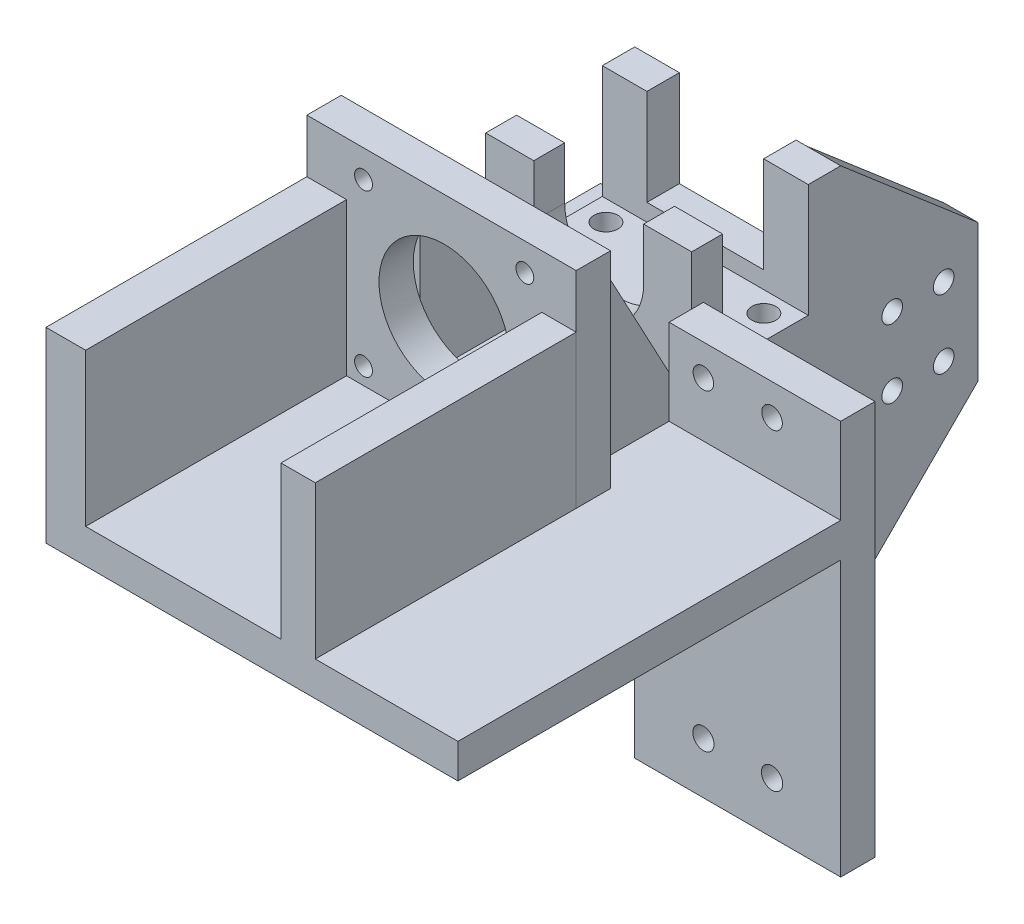
from build123d import *

# Parameters (mm, degrees)
BOSS_EXTRUDE1_DEPTH  = 10
SKETCH2_W            = 60
SKETCH2_H            = 25
BOSS_EXTRUDE2_DEPTH  = 6.45
SKETCH3_W            = 60
SKETCH3_H            = 9.45
BOSS_EXTRUDE3_DEPTH  = 39.45
SKETCH4_W            = 34
SKETCH4_H            = 28
CUT_EXTRUDE1_DEPTH   = 9.45
SKETCH5_W            = 60
SKETCH5_H            = 9
BOSS_EXTRUDE4_DEPTH  = 39.45
CUT_EXTRUDE2_REACH   = 170.798
BOSS_EXTRUDE5_DEPTH  = 80
SKETCH8_W            = 75.99709589
SKETCH8_H            = 54.458409134
BOSS_EXTRUDE6_DEPTH  = 10
SKETCH9_W            = 10
SKETCH9_H            = 75.99709589
BOSS_EXTRUDE7_DEPTH  = 44.46
SKETCH17_W           = 78.45
SKETCH17_H           = 10
BOSS_EXTRUDE27_DEPTH = 60
SKETCH19_W           = 2.5
SKETCH19_H           = 60
BOSS_EXTRUDE31_DEPTH = 32
SKETCH20_W           = 75.99709589
SKETCH20_H           = 44.458409134
BOSS_EXTRUDE32_DEPTH = 1.55
SKETCH21_R           = 2.6
SKETCH21_R_2         = 19
CUT_EXTRUDE3_DEPTH   = 10
CUT_EXTRUDE4_REACH   = 213.153
SKETCH22_R           = 3.5
CUT_EXTRUDE5_REACH   = 191.962
SKETCH23_W           = 27
SKETCH23_H           = 6
CUT_EXTRUDE6_REACH   = 191.962
SKETCH24_R           = 3.1
CUT_EXTRUDE7_REACH   = 177.882
SKETCH25_R           = 3.1
CUT_EXTRUDE10_DEPTH  = 70
SKETCH27_W           = 50
SKETCH27_H           = 10
BOSS_EXTRUDE33_DEPTH = 25
CUT_EXTRUDE11_REACH  = 177.882
SKETCH28_R           = 3
SKETCH29_W           = 10
SKETCH29_H           = 40
BOSS_EXTRUDE34_DEPTH = 40
CUT_EXTRUDE12_REACH  = 226.958
SKETCH30_R           = 3
BOSS_EXTRUDE35_DEPTH = 10
SKETCH34_W           = 85.51
SKETCH34_H           = 10
BOSS_EXTRUDE37_DEPTH = 10


with BuildPart() as part:
    # Sketch1 → Boss-Extrude1 (new body)
    with BuildSketch(Plane(origin=(0, 0, 0), x_dir=(1, 0, 0), z_dir=(0, 1, 0))):
        Polygon((0, 0), (0, 161.51), (60, 161.51), (60, 121.51), (110, 121.51), (110, 0), align=None)
    extrude(amount=BOSS_EXTRUDE1_DEPTH)

    # Sketch2 → Boss-Extrude2 (add)
    with BuildSketch(Plane(origin=(0, 10, 0), x_dir=(1, 0, 0), z_dir=(0, 1, 0))):
        with Locations((30, 139.6)):
            Rectangle(SKETCH2_W, SKETCH2_H)
    extrude(amount=BOSS_EXTRUDE2_DEPTH)

    # Sketch3 → Boss-Extrude3 (add)
    with BuildSketch(Plane(origin=(0, 10, 0), x_dir=(1, 0, 0), z_dir=(0, 1, 0))):
        with Locations((30, 156.785)):
            Rectangle(SKETCH3_W, SKETCH3_H)
    extrude(amount=BOSS_EXTRUDE3_DEPTH)

    # Sketch4 → Cut-Extrude1 (cut)
    with BuildSketch(Plane(origin=(0, 0, -161.51), x_dir=(-1, 0, 0), z_dir=(0, 0, -1))):
        with Locations((-30, 35.45)):
            Rectangle(SKETCH4_W, SKETCH4_H)
    extrude(amount=-CUT_EXTRUDE1_DEPTH, mode=Mode.SUBTRACT)

    # Sketch5 → Boss-Extrude4 (add)
    with BuildSketch(Plane(origin=(0, 10, 0), x_dir=(1, 0, 0), z_dir=(0, 1, 0))):
        with Locations((30, 122.6)):
            Rectangle(SKETCH5_W, SKETCH5_H)
    extrude(amount=BOSS_EXTRUDE4_DEPTH)

    # Sketch6 → Cut-Extrude2 (cut, up to next)
    with BuildSketch(Plane.XY.offset(-118.1), mode=Mode.PRIVATE) as cut_extrude2_sk1:
        with BuildLine():
            Line((14, 34.24), (14, 49.45))
            Line((14, 49.45), (46, 49.45))
            Line((46, 49.45), (46, 34.24))
            ThreePointArc((46, 34.24), (30, 18.24), (14, 34.24))
        make_face()
    cut_extrude2_tool1 = extrude(cut_extrude2_sk1.sketch, amount=-CUT_EXTRUDE2_REACH, mode=Mode.PRIVATE) & part.part
    add(cut_extrude2_tool1.solids().sort_by_distance((30, 35.332249, -118.1))[0], mode=Mode.SUBTRACT)

    # Sketch7 → Boss-Extrude5 (add)
    with BuildSketch(Plane.XZ):
        Polygon((110, -111.51), (50, -111.51), (50, -161.51), (60, -161.51), (60, -121.51), (110, -121.51), align=None)
    extrude(amount=BOSS_EXTRUDE5_DEPTH)

    # Sketch8 → Boss-Extrude6 (add)
    with BuildSketch(Plane.ZY):
        with Locations((-37.998547945, 27.229204567)):
            Rectangle(SKETCH8_W, SKETCH8_H)
    extrude(amount=BOSS_EXTRUDE6_DEPTH)

    # Sketch9 → Boss-Extrude7 (add)
    with BuildSketch(Plane(origin=(0, 10, 0), x_dir=(1, 0, 0), z_dir=(0, 1, 0))):
        with Locations((63.45, 37.998547945)):
            Rectangle(SKETCH9_W, SKETCH9_H)
    extrude(amount=BOSS_EXTRUDE7_DEPTH)

    # Sketch17 → Boss-Extrude27 (add)
    with BuildSketch(Plane(origin=(0, 10, 0), x_dir=(1, 0, 0), z_dir=(0, 1, 0))):
        with Locations((29.225, 81)):
            Rectangle(SKETCH17_W, SKETCH17_H)
    extrude(amount=BOSS_EXTRUDE27_DEPTH)

    # Sketch19 → Boss-Extrude31 (add)
    with BuildSketch(Plane(origin=(0, 0, -86), x_dir=(-1, 0, 0), z_dir=(0, 0, -1))):
        with Locations((-1.25, 40)):
            Rectangle(SKETCH19_W, SKETCH19_H)
        with Locations((-11.75, 40)):
            Rectangle(SKETCH19_W, SKETCH19_H)
        with Locations((-48.25, 40)):
            Rectangle(SKETCH19_W, SKETCH19_H)
        with Locations((-58.75, 40)):
            Rectangle(SKETCH19_W, SKETCH19_H)
    extrude(amount=BOSS_EXTRUDE31_DEPTH)

    # Sketch20 → Boss-Extrude32 (add)
    with BuildSketch(Plane(origin=(0, 0, 0), x_dir=(0, 0, -1), z_dir=(1, 0, 0))):
        with Locations((37.998547945, 32.229204567)):
            Rectangle(SKETCH20_W, SKETCH20_H)
    extrude(amount=BOSS_EXTRUDE32_DEPTH)

    # Sketch21 → Cut-Extrude3 (cut)
    with BuildSketch(Plane.XY.offset(-76)):
        with Locations((6.5, 61.95)):
            Circle(SKETCH21_R)
        with Locations((53.5, 61.95)):
            Circle(SKETCH21_R)
        with Locations((53.5, 14.95)):
            Circle(SKETCH21_R)
        with Locations((6.5, 14.95)):
            Circle(SKETCH21_R)
        with Locations((30, 38.45)):
            Circle(SKETCH21_R_2)
    extrude(amount=-CUT_EXTRUDE3_DEPTH, mode=Mode.SUBTRACT)

    # Sketch22 → Cut-Extrude4 (cut, up to next)
    with BuildSketch(Plane.XZ, mode=Mode.PRIVATE) as cut_extrude4_sk1:
        with Locations((7.02, -146.1)):
            Circle(SKETCH22_R)
    cut_extrude4_tool1 = extrude(cut_extrude4_sk1.sketch, amount=-CUT_EXTRUDE4_REACH, mode=Mode.PRIVATE) & part.part
    # Sketch22 → Cut-Extrude4 (cut, up to next)
    with BuildSketch(Plane.XZ, mode=Mode.PRIVATE) as cut_extrude4_sk2:
        with Locations((7.02, -133)):
            Circle(SKETCH22_R)
    cut_extrude4_tool2 = extrude(cut_extrude4_sk2.sketch, amount=-CUT_EXTRUDE4_REACH, mode=Mode.PRIVATE) & part.part
    # Sketch22 → Cut-Extrude4 (cut, up to next)
    with BuildSketch(Plane.XZ, mode=Mode.PRIVATE) as cut_extrude4_sk3:
        with Locations((53.02, -146.1)):
            Circle(SKETCH22_R)
    cut_extrude4_tool3 = extrude(cut_extrude4_sk3.sketch, amount=-CUT_EXTRUDE4_REACH, mode=Mode.PRIVATE) & part.part
    # Sketch22 → Cut-Extrude4 (cut, up to next)
    with BuildSketch(Plane.XZ, mode=Mode.PRIVATE) as cut_extrude4_sk4:
        with Locations((53.02, -133)):
            Circle(SKETCH22_R)
    cut_extrude4_tool4 = extrude(cut_extrude4_sk4.sketch, amount=-CUT_EXTRUDE4_REACH, mode=Mode.PRIVATE) & part.part
    add(cut_extrude4_tool1.solids().sort_by_distance((7.02, 0, -146.1))[0], mode=Mode.SUBTRACT)
    add(cut_extrude4_tool2.solids().sort_by_distance((7.02, 0, -133))[0], mode=Mode.SUBTRACT)
    add(cut_extrude4_tool3.solids().sort_by_distance((53.02, 0, -146.1))[0], mode=Mode.SUBTRACT)
    add(cut_extrude4_tool4.solids().sort_by_distance((53.02, 0, -133))[0], mode=Mode.SUBTRACT)

    # Sketch23 → Cut-Extrude5 (cut, up to next)
    with BuildSketch(Plane.ZY.offset(-50), mode=Mode.PRIVATE) as cut_extrude5_sk1:
        with Locations((-139.6, -3)):
            Rectangle(SKETCH23_W, SKETCH23_H)
    cut_extrude5_tool1 = extrude(cut_extrude5_sk1.sketch, amount=-CUT_EXTRUDE5_REACH, mode=Mode.PRIVATE) & part.part
    add(cut_extrude5_tool1.solids().sort_by_distance((50, -3, -139.6))[0], mode=Mode.SUBTRACT)

    # Sketch24 → Cut-Extrude6 (cut, up to next)
    with BuildSketch(Plane.ZY.offset(-50), mode=Mode.PRIVATE) as cut_extrude6_sk1:
        with Locations((-151.51, -15)):
            Circle(SKETCH24_R)
    cut_extrude6_tool1 = extrude(cut_extrude6_sk1.sketch, amount=-CUT_EXTRUDE6_REACH, mode=Mode.PRIVATE) & part.part
    # Sketch24 → Cut-Extrude6 (cut, up to next)
    with BuildSketch(Plane.ZY.offset(-50), mode=Mode.PRIVATE) as cut_extrude6_sk2:
        with Locations((-151.51, -65)):
            Circle(SKETCH24_R)
    cut_extrude6_tool2 = extrude(cut_extrude6_sk2.sketch, amount=-CUT_EXTRUDE6_REACH, mode=Mode.PRIVATE) & part.part
    # Sketch24 → Cut-Extrude6 (cut, up to next)
    with BuildSketch(Plane.ZY.offset(-50), mode=Mode.PRIVATE) as cut_extrude6_sk3:
        with Locations((-131.51, -15)):
            Circle(SKETCH24_R)
    cut_extrude6_tool3 = extrude(cut_extrude6_sk3.sketch, amount=-CUT_EXTRUDE6_REACH, mode=Mode.PRIVATE) & part.part
    # Sketch24 → Cut-Extrude6 (cut, up to next)
    with BuildSketch(Plane.ZY.offset(-50), mode=Mode.PRIVATE) as cut_extrude6_sk4:
        with Locations((-131.51, -65)):
            Circle(SKETCH24_R)
    cut_extrude6_tool4 = extrude(cut_extrude6_sk4.sketch, amount=-CUT_EXTRUDE6_REACH, mode=Mode.PRIVATE) & part.part
    add(cut_extrude6_tool1.solids().sort_by_distance((50, -15, -151.51))[0], mode=Mode.SUBTRACT)
    add(cut_extrude6_tool2.solids().sort_by_distance((50, -65, -151.51))[0], mode=Mode.SUBTRACT)
    add(cut_extrude6_tool3.solids().sort_by_distance((50, -15, -131.51))[0], mode=Mode.SUBTRACT)
    add(cut_extrude6_tool4.solids().sort_by_distance((50, -65, -131.51))[0], mode=Mode.SUBTRACT)

    # Sketch25 → Cut-Extrude7 (cut, up to next)
    with BuildSketch(Plane.XY.offset(-111.51), mode=Mode.PRIVATE) as cut_extrude7_sk1:
        with Locations((70, -15)):
            Circle(SKETCH25_R)
    cut_extrude7_tool1 = extrude(cut_extrude7_sk1.sketch, amount=-CUT_EXTRUDE7_REACH, mode=Mode.PRIVATE) & part.part
    # Sketch25 → Cut-Extrude7 (cut, up to next)
    with BuildSketch(Plane.XY.offset(-111.51), mode=Mode.PRIVATE) as cut_extrude7_sk2:
        with Locations((90, -15)):
            Circle(SKETCH25_R)
    cut_extrude7_tool2 = extrude(cut_extrude7_sk2.sketch, amount=-CUT_EXTRUDE7_REACH, mode=Mode.PRIVATE) & part.part
    # Sketch25 → Cut-Extrude7 (cut, up to next)
    with BuildSketch(Plane.XY.offset(-111.51), mode=Mode.PRIVATE) as cut_extrude7_sk3:
        with Locations((70, -65)):
            Circle(SKETCH25_R)
    cut_extrude7_tool3 = extrude(cut_extrude7_sk3.sketch, amount=-CUT_EXTRUDE7_REACH, mode=Mode.PRIVATE) & part.part
    # Sketch25 → Cut-Extrude7 (cut, up to next)
    with BuildSketch(Plane.XY.offset(-111.51), mode=Mode.PRIVATE) as cut_extrude7_sk4:
        with Locations((90, -65)):
            Circle(SKETCH25_R)
    cut_extrude7_tool4 = extrude(cut_extrude7_sk4.sketch, amount=-CUT_EXTRUDE7_REACH, mode=Mode.PRIVATE) & part.part
    add(cut_extrude7_tool1.solids().sort_by_distance((70, -15, -111.51))[0], mode=Mode.SUBTRACT)
    add(cut_extrude7_tool2.solids().sort_by_distance((90, -15, -111.51))[0], mode=Mode.SUBTRACT)
    add(cut_extrude7_tool3.solids().sort_by_distance((70, -65, -111.51))[0], mode=Mode.SUBTRACT)
    add(cut_extrude7_tool4.solids().sort_by_distance((90, -65, -111.51))[0], mode=Mode.SUBTRACT)

    # Sketch26 → Cut-Extrude10 (cut)
    with BuildSketch(Plane.ZY):
        Polygon((-118.1, 10), (-86, 70), (-118, 70), align=None)
    extrude(amount=-CUT_EXTRUDE10_DEPTH, mode=Mode.SUBTRACT)

    # Sketch27 → Boss-Extrude33 (add)
    with BuildSketch(Plane(origin=(0, 10, 0), x_dir=(1, 0, 0), z_dir=(0, 1, 0))):
        with Locations((85, 116.51)):
            Rectangle(SKETCH27_W, SKETCH27_H)
    extrude(amount=BOSS_EXTRUDE33_DEPTH)

    # Sketch28 → Cut-Extrude11 (cut, up to next)
    with BuildSketch(Plane.XY.offset(-111.51), mode=Mode.PRIVATE) as cut_extrude11_sk1:
        with Locations((90, 25.935)):
            Circle(SKETCH28_R)
    cut_extrude11_tool1 = extrude(cut_extrude11_sk1.sketch, amount=-CUT_EXTRUDE11_REACH, mode=Mode.PRIVATE) & part.part
    # Sketch28 → Cut-Extrude11 (cut, up to next)
    with BuildSketch(Plane.XY.offset(-111.51), mode=Mode.PRIVATE) as cut_extrude11_sk2:
        with Locations((70, 25.935)):
            Circle(SKETCH28_R)
    cut_extrude11_tool2 = extrude(cut_extrude11_sk2.sketch, amount=-CUT_EXTRUDE11_REACH, mode=Mode.PRIVATE) & part.part
    add(cut_extrude11_tool1.solids().sort_by_distance((90, 25.935, -111.51))[0], mode=Mode.SUBTRACT)
    add(cut_extrude11_tool2.solids().sort_by_distance((70, 25.935, -111.51))[0], mode=Mode.SUBTRACT)

    # Sketch29 → Boss-Extrude34 (add)
    with BuildSketch(Plane(origin=(0, 0, -161.51), x_dir=(-1, 0, 0), z_dir=(0, 0, -1))):
        with Locations((-55, -4.85)):
            Rectangle(SKETCH29_W, SKETCH29_H)
    extrude(amount=BOSS_EXTRUDE34_DEPTH)

    # Sketch30 → Cut-Extrude12 (cut, up to next)
    with BuildSketch(Plane.ZY.offset(-50), mode=Mode.PRIVATE) as cut_extrude12_sk1:
        with Locations((-191.51, 5.15)):
            Circle(SKETCH30_R)
    cut_extrude12_tool1 = extrude(cut_extrude12_sk1.sketch, amount=-CUT_EXTRUDE12_REACH, mode=Mode.PRIVATE) & part.part
    # Sketch30 → Cut-Extrude12 (cut, up to next)
    with BuildSketch(Plane.ZY.offset(-50), mode=Mode.PRIVATE) as cut_extrude12_sk2:
        with Locations((-176.51, 5.15)):
            Circle(SKETCH30_R)
    cut_extrude12_tool2 = extrude(cut_extrude12_sk2.sketch, amount=-CUT_EXTRUDE12_REACH, mode=Mode.PRIVATE) & part.part
    # Sketch30 → Cut-Extrude12 (cut, up to next)
    with BuildSketch(Plane.ZY.offset(-50), mode=Mode.PRIVATE) as cut_extrude12_sk3:
        with Locations((-191.51, -14.85)):
            Circle(SKETCH30_R)
    cut_extrude12_tool3 = extrude(cut_extrude12_sk3.sketch, amount=-CUT_EXTRUDE12_REACH, mode=Mode.PRIVATE) & part.part
    # Sketch30 → Cut-Extrude12 (cut, up to next)
    with BuildSketch(Plane.ZY.offset(-50), mode=Mode.PRIVATE) as cut_extrude12_sk4:
        with Locations((-176.51, -14.85)):
            Circle(SKETCH30_R)
    cut_extrude12_tool4 = extrude(cut_extrude12_sk4.sketch, amount=-CUT_EXTRUDE12_REACH, mode=Mode.PRIVATE) & part.part
    add(cut_extrude12_tool1.solids().sort_by_distance((50, 5.15, -191.51))[0], mode=Mode.SUBTRACT)
    add(cut_extrude12_tool2.solids().sort_by_distance((50, 5.15, -176.51))[0], mode=Mode.SUBTRACT)
    add(cut_extrude12_tool3.solids().sort_by_distance((50, -14.85, -191.51))[0], mode=Mode.SUBTRACT)
    add(cut_extrude12_tool4.solids().sort_by_distance((50, -14.85, -176.51))[0], mode=Mode.SUBTRACT)

    # Sketch31 → Boss-Extrude35 (add)
    with BuildSketch(Plane.ZY.offset(-50)):
        Polygon((-161.51, 15.15), (-161.51, 49.45), (-201.51, 15.15), align=None)
        Polygon((-161.51, -24.85), (-201.51, -24.85), (-161.51, -64.85), align=None)
    extrude(amount=-BOSS_EXTRUDE35_DEPTH)

    # Sketch34 → Boss-Extrude37 (add)
    with BuildSketch(Plane.ZY):
        with Locations((-118.755, 5)):
            Rectangle(SKETCH34_W, SKETCH34_H)
    extrude(amount=BOSS_EXTRUDE37_DEPTH)


solid = part.part
